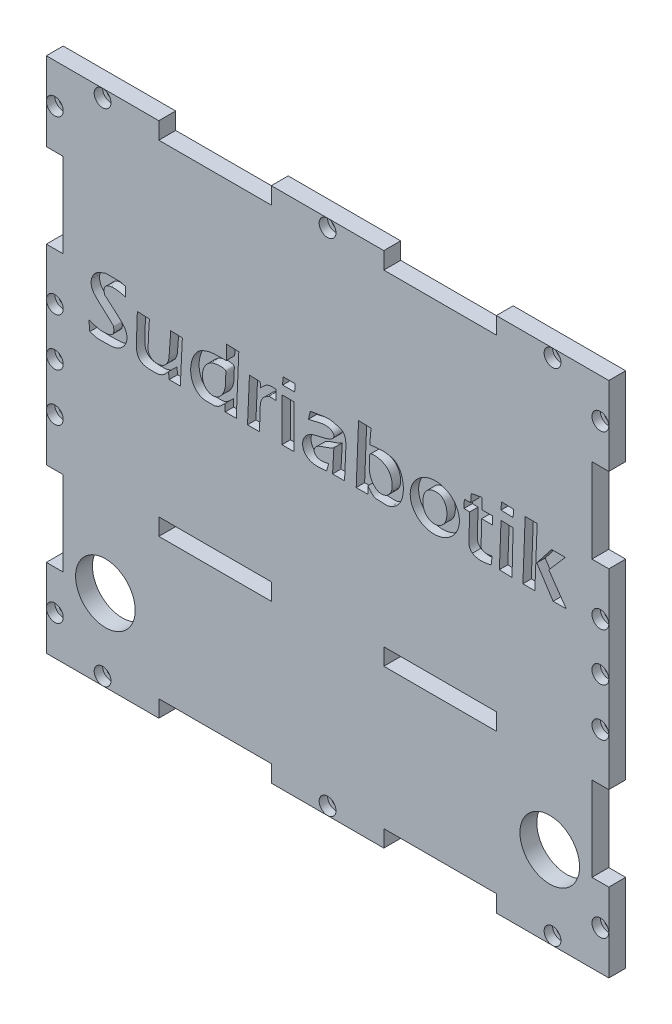
from build123d import *

# Parameters (mm, degrees)
ESQUISSE1_W             = 200
ESQUISSE1_H             = 184
BOSS_EXTRU_1_DEPTH      = 6
ESQUISSE2_W             = 40
ESQUISSE2_H             = 6
ESQUISSE2_W_2           = 6
ESQUISSE2_H_2           = 30
ENL_V_MAT_EXTRU_1_DEPTH = 6
ESQUISSE4_R             = 10.6
ENL_V_MAT_EXTRU_2_DEPTH = 10
ESQUISSE6_W             = 40
ESQUISSE6_H             = 6
ENL_V_MAT_EXTRU_3_DEPTH = 6
ESQUISSE7_R             = 1.5
ENL_V_MAT_EXTRU_4_DEPTH = 6
ESQUISSE8_R             = 2.995
ENL_V_MAT_EXTRU_5_DEPTH = 3
ENL_V_START             = -3
ENL_V_MAT_EXTRU_7_DEPTH = 3


# Read off the part's stored shape, not the designer's step: Enlèv. mat.-Extru.7
with BuildPart() as part:
    # Esquisse1 → Boss.-Extru.1 (new body)
    with BuildSketch(Plane.XY):
        Rectangle(ESQUISSE1_W, ESQUISSE1_H)
    extrude(amount=BOSS_EXTRU_1_DEPTH)

    # Esquisse2 → Enlèv. mat.-Extru.1 (cut)
    with BuildSketch(Plane.XY.offset(6)):
        with Locations((-40, 89)):
            Rectangle(ESQUISSE2_W, ESQUISSE2_H)
        with Locations((40, 89)):
            Rectangle(ESQUISSE2_W, ESQUISSE2_H)
        with Locations((-97, 49)):
            Rectangle(ESQUISSE2_W_2, ESQUISSE2_H_2)
        with Locations((-97, -49)):
            Rectangle(ESQUISSE2_W_2, ESQUISSE2_H_2)
        with Locations((97, -49)):
            Rectangle(ESQUISSE2_W_2, ESQUISSE2_H_2)
        with Locations((97, 49)):
            Rectangle(ESQUISSE2_W_2, ESQUISSE2_H_2)
        with Locations((-40, -89)):
            Rectangle(ESQUISSE2_W, ESQUISSE2_H)
        with Locations((40, -89)):
            Rectangle(ESQUISSE2_W, ESQUISSE2_H)
    extrude(amount=-ENL_V_MAT_EXTRU_1_DEPTH, mode=Mode.SUBTRACT)

    # Esquisse4 → Enlèv. mat.-Extru.2 (cut)
    with BuildSketch(Plane(origin=(0, 0, 0), x_dir=(-1, 0, 0), z_dir=(0, 0, -1))):
        with Locations((-79.000000012, -62.999999968)):
            Circle(ESQUISSE4_R)
        with Locations((79, -63)):
            Circle(ESQUISSE4_R)
    extrude(amount=-ENL_V_MAT_EXTRU_2_DEPTH, mode=Mode.SUBTRACT)

    # Esquisse6 → Enlèv. mat.-Extru.3 (cut)
    with BuildSketch(Plane(origin=(0, 0, 0), x_dir=(-1, 0, 0), z_dir=(0, 0, -1))):
        with Locations((-40, -33)):
            Rectangle(ESQUISSE6_W, ESQUISSE6_H)
        with Locations((40, -33)):
            Rectangle(ESQUISSE6_W, ESQUISSE6_H)
    extrude(amount=-ENL_V_MAT_EXTRU_3_DEPTH, mode=Mode.SUBTRACT)

    # Esquisse7 → Enlèv. mat.-Extru.4 (cut)
    with BuildSketch(Plane.XY.offset(6)):
        with Locations(Location((0, 89, 0), (0, 0, 180))):
            Circle(ESQUISSE7_R)
        with Locations((97, 0)):
            Circle(ESQUISSE7_R)
        with Locations((-97, 0)):
            Circle(ESQUISSE7_R)
        with Locations((-80, 89)):
            Circle(ESQUISSE7_R)
        with Locations((-97, 78)):
            Circle(ESQUISSE7_R)
        with Locations(Location((97, 78, 0), (0, 0, 180))):
            Circle(ESQUISSE7_R)
        with Locations(Location((80, 89, 0), (0, 0, 180))):
            Circle(ESQUISSE7_R)
        with Locations((80, -89)):
            Circle(ESQUISSE7_R)
        with Locations((97, -78)):
            Circle(ESQUISSE7_R)
        with Locations(Location((-97, -78, 0), (0, 0, 180))):
            Circle(ESQUISSE7_R)
        with Locations(Location((-80, -89, 0), (0, 0, 180))):
            Circle(ESQUISSE7_R)
        with Locations((-97, 17)):
            Circle(ESQUISSE7_R)
        with Locations(Location((-97, -17, 0), (0, 0, 180))):
            Circle(ESQUISSE7_R)
        with Locations((97, -17)):
            Circle(ESQUISSE7_R)
        with Locations(Location((97, 17, 0), (0, 0, 180))):
            Circle(ESQUISSE7_R)
        with Locations((0, -89)):
            Circle(ESQUISSE7_R)
    extrude(amount=-ENL_V_MAT_EXTRU_4_DEPTH, mode=Mode.SUBTRACT)

    # Esquisse8 → Enlèv. mat.-Extru.5 (cut)
    with BuildSketch(Plane.XY.offset(6)):
        with Locations((-97, 0)):
            Circle(ESQUISSE8_R)
        with Locations((97, 0)):
            Circle(ESQUISSE8_R)
        with Locations((0, 89)):
            Circle(ESQUISSE8_R)
        with Locations((-97, -78)):
            Circle(ESQUISSE8_R)
        with Locations((-80, -89)):
            Circle(ESQUISSE8_R)
        with Locations(Location((80, -89, 0), (0, 0, 180))):
            Circle(ESQUISSE8_R)
        with Locations(Location((97, -78, 0), (0, 0, 180))):
            Circle(ESQUISSE8_R)
        with Locations((97, 78)):
            Circle(ESQUISSE8_R)
        with Locations((80, 89)):
            Circle(ESQUISSE8_R)
        with Locations(Location((-80, 89, 0), (0, 0, 180))):
            Circle(ESQUISSE8_R)
        with Locations(Location((-97, 78, 0), (0, 0, 180))):
            Circle(ESQUISSE8_R)
        with Locations((-97, 17)):
            Circle(ESQUISSE8_R)
        with Locations((-97, -17)):
            Circle(ESQUISSE8_R)
        with Locations(Location((97, -17, 0), (0, 0, 180))):
            Circle(ESQUISSE8_R)
        with Locations(Location((97, 17, 0), (0, 0, 180))):
            Circle(ESQUISSE8_R)
        with Locations(Location((0, -89, 0), (0, 0, 180))):
            Circle(ESQUISSE8_R)
    extrude(amount=-ENL_V_MAT_EXTRU_5_DEPTH, mode=Mode.SUBTRACT)

    # Enlèv. mat.-Extru.7 outline → Enlèv. mat.-Extru.7 (cut)
    # profile 1 of 14: a face of its own
    with BuildSketch(Plane.XY.offset(6).offset(ENL_V_START)):
        with BuildLine():
            Line((-71.832274603, 31.775350087), (-71.832274603, 35.076040061))
            add(Edge.make_bspline(
                [(-71.832274603, 35.076040061), (-75.444418075, 35.592060557), (-70.361003489, 35.571143557), (-78.763723548, 35.571143557), (-79.051613727, 35.571143557), (-81.515454032, 34.561829061), (-81.734344525, 34.415902066), (-84.022707636, 32.890326659), (-84.960698486, 29.626776167), (-83.054620514, 27.319418622), (-81.989048152, 26.029515237), (-80.688212082, 24.949464617), (-79.423861543, 23.85369415), (-78.335828919, 22.910732542), (-77.306290441, 21.901157547), (-76.288206068, 20.883073173), (-76.233194568, 20.828061674), (-76.138429014, 20.794325898), (-76.123171569, 20.718038674), (-75.428216674, 17.243264199), (-77.631067434, 17.087279703), (-80.414068535, 17.087279703), (-80.748690424, 17.087279703), (-81.076831351, 17.183378586), (-81.404275527, 17.252314202), (-82.122477197, 17.403514553), (-82.844018368, 17.545787514), (-83.54972401, 17.747417698), (-83.814143096, 17.822966008), (-83.812323658, 17.940327953), (-84.87, 18.242521194)],
                knots=[0, 0, 0, 0, 1, 1, 1, 2, 2, 2, 3, 3, 3, 4, 4, 4, 5, 5, 5, 6, 6, 6, 7, 7, 7, 8, 8, 8, 9, 9, 9, 10, 10, 10, 10], degree=3))
            Line((-84.87, 18.242521194), (-84.539931003, 14.776796721))
            add(Edge.make_bspline(
                [(-84.539931003, 14.776796721), (-80.92259241, 13.972943701), (-83.913476475, 13.965242805), (-76.948344063, 14.116658727), (-73.316399376, 14.195614046), (-70.281527239, 17.649880516), (-71.667240104, 21.21314217), (-72.591261948, 23.589198341), (-76.80250554, 26.348407606), (-78.763723548, 28.309625614), (-78.928758047, 28.474660113), (-79.190189164, 28.581655999), (-79.258827044, 28.80472911), (-80.23577747, 31.979817995), (-77.617572533, 32.642538745), (-75.132964577, 32.435488082), (-74.014821462, 32.342309489), (-72.932504594, 31.995396085), (-71.832274603, 31.775350087)],
                knots=[0, 0, 0, 0, 1, 1, 1, 2, 2, 2, 3, 3, 3, 4, 4, 4, 5, 5, 5, 6, 6, 6, 6], degree=3))
        make_face()
    # profile 2 of 14: a face of its own
    with BuildSketch(Plane.XY.offset(6).offset(ENL_V_START)):
        with BuildLine():
            Line((-35.854753887, 35.24107456), (-36.019663664, 30.128871488))
            add(Edge.make_bspline(
                [(-36.019663664, 30.128871488), (-39.153732772, 30.101065387), (-41.993701799, 30.323488501), (-44.919462564, 28.729582703), (-48.995119726, 26.509232473), (-50.040512384, 18.499854074), (-46.617637632, 15.511236627), (-44.801291547, 13.925328876), (-43.181622248, 14.056352711), (-40.663452041, 14.078694431), (-40.328843322, 14.081663148), (-39.988864748, 14.137170552), (-39.674748181, 14.252507408), (-38.100157167, 14.830663405), (-37.742458015, 15.500933689), (-36.396150541, 16.757210706)],
                knots=[0, 0, 0, 0, 1, 1, 1, 2, 2, 2, 3, 3, 3, 4, 4, 4, 5, 5, 5, 5], degree=3))
            Line((-36.396150541, 16.757210706), (-36.396150541, 14.111775978))
            Line((-36.396150541, 14.111775978), (-32.461830671, 14.111775978))
            Line((-32.461830671, 14.111775978), (-31.563856921, 35.076040061))
            Line((-31.563856921, 35.076040061), (-35.854753887, 35.24107456))
        make_face()
        with BuildLine():
            add(Edge.make_bspline(
                [(-36.213007407, 26.824315126), (-36.770508032, 27.847371932), (-40.057823535, 27.38285396), (-41.649690342, 27.344614236), (-44.061546879, 26.947566468), (-43.701198768, 24.392165497), (-44.967721967, 23.835570442), (-44.952732727, 22.064495793), (-45.241959164, 19.924709536), (-46.32353477, 17.901713818), (-44.765170086, 15.731586823), (-41.21419285, 14.604050905), (-37.702792527, 14.196932027), (-37.514282923, 17.424745861), (-36.533817611, 19.174690279), (-36.32652025, 21.676728394), (-34.637556869, 23.00287742), (-37.827821034, 23.290626737), (-35.655506782, 25.80125832), (-36.213007407, 26.824315126)],
                knots=[0, 0, 0, 0, 0, 0, 0, 0, 0, 0, 0, 0, 0, 0, 0, 0, 0, 0, 0, 0, 1, 1, 1, 1, 1, 1, 1, 1, 1, 1, 1, 1, 1, 1, 1, 1, 1, 1, 1, 1], degree=19))
        make_face(mode=Mode.SUBTRACT)
    # profile 3 of 14: a face of its own
    with BuildSketch(Plane.XY.offset(6).offset(ENL_V_START)):
        with BuildLine():
            Line((14.315733716, 14.111775978), (14.315733716, 16.71063796))
            add(Edge.make_bspline(
                [(14.315733716, 16.71063796), (15.01441761, 16.011954067), (16.087203721, 14.321296852), (17.121320194, 14.23512048), (18.383405363, 14.129946716), (19.650653837, 14.070085981), (20.917113664, 14.070085981), (21.947384958, 14.070085981), (23.125399227, 14.717103863), (23.887734641, 15.225327472), (27.639413123, 17.72644646), (27.638597999, 24.165702993), (25.538079628, 27.602914874), (25.158292567, 28.224384609), (24.255696789, 29.15653268), (23.557665643, 29.41829436), (20.627655537, 30.517048149), (18.216920146, 30.08364423), (14.975871711, 29.748363357)],
                knots=[0, 0, 0, 0, 1, 1, 1, 2, 2, 2, 3, 3, 3, 4, 4, 4, 5, 5, 5, 6, 6, 6, 6], degree=3))
            Line((14.975871711, 29.748363357), (15.470975207, 35.029467315))
            Line((15.470975207, 35.029467315), (11.015043742, 35.194501814))
            Line((11.015043742, 35.194501814), (10.178427638, 14.111775978))
            Line((10.178427638, 14.111775978), (14.315733716, 14.111775978))
        make_face()
        with BuildLine():
            add(Edge.make_bspline(
                [(15.051477534, 26.817766588), (14.4292009, 25.832767114), (16.233873095, 23.314534792), (13.233014276, 23.105809973), (14.832997235, 21.673565904), (14.878609608, 19.16336941), (15.74425425, 17.353873058), (15.72434236, 14.120620588), (19.254680906, 14.300586599), (22.870944288, 15.196921207), (24.565931783, 17.262101357), (23.616984956, 19.350597799), (23.466267043, 21.504575809), (23.595369225, 23.271002348), (22.367351161, 23.908066476), (22.891643309, 26.434930664), (20.510390385, 26.986594867), (18.722979632, 27.254532691), (15.673754168, 27.802766063), (15.051477534, 26.817766588)],
                knots=[0, 0, 0, 0, 0, 0, 0, 0, 0, 0, 0, 0, 0, 0, 0, 0, 0, 0, 0, 0, 1, 1, 1, 1, 1, 1, 1, 1, 1, 1, 1, 1, 1, 1, 1, 1, 1, 1, 1, 1], degree=19))
        make_face(mode=Mode.SUBTRACT)
    # profile 4 of 14: a face of its own
    with BuildSketch(Plane.XY.offset(6).offset(ENL_V_START)):
        with BuildLine():
            Line((58.534231493, 17.209633661), (57.059668878, 16.922245204))
            add(Edge.make_bspline(
                [(57.059668878, 16.922245204), (56.509553883, 16.977256704), (55.933811733, 16.912450422), (55.409323892, 17.087279703), (55.075154501, 17.1986695), (54.859208896, 17.5273717), (54.584151398, 17.747417698)],
                knots=[0, 0, 0, 0, 1, 1, 1, 2, 2, 2, 2], degree=3))
            Line((54.584151398, 17.747417698), (54.773897403, 26.824315126))
            Line((54.773897403, 26.824315126), (58.710013865, 26.824315126))
            Line((58.710013865, 26.824315126), (58.710013865, 29.629901604))
            Line((58.710013865, 29.629901604), (54.914220395, 29.629901604))
            Line((54.914220395, 29.629901604), (54.914220395, 33.425695074))
            Line((54.914220395, 33.425695074), (54.584151398, 33.425695074))
            Line((54.584151398, 33.425695074), (51.118426925, 32.765557079))
            Line((51.118426925, 32.765557079), (50.871443908, 29.794936103))
            Line((50.871443908, 29.794936103), (48.642909445, 29.794936103))
            Line((48.642909445, 29.794936103), (48.497786628, 26.824315126))
            Line((48.497786628, 26.824315126), (50.508507889, 26.768751477))
            add(Edge.make_bspline(
                [(50.508507889, 26.768751477), (50.453539896, 24.3372525), (50.449969548, 21.904047769), (50.343603909, 19.474254546), (50.292890852, 18.315776665), (50.154207376, 17.124406219), (50.422984111, 15.996398293), (50.480447319, 15.755235478), (50.971848976, 14.990281361), (51.478439966, 14.544237043)],
                knots=[1.305700193, 1.305700193, 1.305700193, 1.305700193, 2.305700193, 2.305700193, 2.305700193, 3.305700193, 3.305700193, 3.305700193, 4, 4, 4, 4], degree=3))
            add(Edge.make_bspline(
                [(51.478439966, 14.544237043), (54.122648347, 13.117415432), (56.316025086, 13.952464869), (57.480594776, 14.12), (58.154811729, 14.281693225)],
                knots=[0, 0, 0, 0, 0, 1, 1, 1, 1, 1], degree=4))
            Line((58.154811729, 14.281693225), (58.534231493, 17.209633661))
        make_face()
    # profile 5 of 14: a face of its own
    with BuildSketch(Plane.XY.offset(6).offset(ENL_V_START)):
        with BuildLine():
            Line((-18.361097026, 26.628871451), (-18.361097026, 30.1250051))
            add(Edge.make_bspline(
                [(-18.361097026, 30.1250051), (-21.315613192, 30.393597479), (-21.705284977, 29.916472624), (-23.807235483, 27.814522118)],
                knots=[0, 0, 0, 0, 1, 1, 1, 1], degree=3))
            Line((-23.807235483, 27.814522118), (-23.972269981, 29.629901604))
            Line((-23.972269981, 29.629901604), (-27.768063451, 29.794936103))
            Line((-27.768063451, 29.794936103), (-28.469276484, 14.111775978))
            Line((-28.469276484, 14.111775978), (-24.176043536, 14.111775978))
            add(Edge.make_bspline(
                [(-24.176043536, 14.111775978), (-24.122694836, 16.534193816), (-24.104476162, 18.957640266), (-24.015997437, 21.379029491), (-23.920034803, 24.00523017), (-23.329683884, 25.503860342), (-21.000925865, 26.567077813), (-20.930154969, 26.599388964), (-20.917575368, 26.734108605), (-20.839798665, 26.735929218), (-20.01302097, 26.755282594), (-19.187330905, 26.664557373), (-18.361097026, 26.628871451)],
                knots=[0, 0, 0, 0, 1, 1, 1, 2, 2, 2, 3, 3, 3, 4, 4, 4, 4], degree=3))
        make_face()
    # profile 6 of 14: a face of its own
    with BuildSketch(Plane.XY.offset(6).offset(ENL_V_START)):
        with BuildLine():
            Line((6.03421537, 14.111775978), (6.559112278, 25.834108134))
            add(Edge.make_bspline(
                [(6.559112278, 25.834108134), (6.288171736, 27.324281115), (6.426788657, 27.833188198), (5.403870787, 28.969763609), (4.989042825, 29.430683567), (3.147277968, 29.880361634), (2.928353306, 29.959970601), (-0.011300684, 31.028935689), (-3.201098633, 29.792361048), (-6.148544122, 29.464867105)],
                knots=[0, 0, 0, 0, 1, 1, 1, 2, 2, 2, 3, 3, 3, 3], degree=3))
            Line((-6.148544122, 29.464867105), (-6.808682117, 26.659280627))
            add(Edge.make_bspline(
                [(-6.808682117, 26.659280627), (-2.96649641, 27.619827054), (-1.094002081, 27.997276809), (1.328557302, 28.971295529), (3.380656572, 26.739689603), (3.130735869, 25.481313483), (1.880431869, 24.519703915), (-1.028411046, 23.724475661)],
                knots=[0, 0, 0, 0, 0, 0, 0, 0, 1, 1, 1, 1, 1, 1, 1, 1], degree=7))
            add(Edge.make_bspline(
                [(-1.028411046, 23.724475661), (-2.201911295, 23.377360175), (-4.550032459, 22.81139558), (-8.106341621, 22.965762655), (-7.821635056, 21.708993667), (-10.914874822, 19.2145908), (-9.843269246, 16.420165715), (-8.534307515, 14.943578235), (-7.598230467, 13.828823758), (-5.312424389, 13.287937321), (-2.966524315, 13.74664657), (-0.356550374, 13.952464869)],
                knots=[0, 0, 0, 0, 0, 0, 0, 0, 0, 0, 0, 0, 1, 1, 1, 1, 1, 1, 1, 1, 1, 1, 1, 1], degree=11))
            Line((-0.356550374, 13.952464869), (0.367732791, 16.544695236))
            add(Edge.make_bspline(
                [(0.367732791, 16.544695236), (-1.097553052, 16.186628196), (-2.454542042, 16.186628196), (-3.975255041, 15.568179336), (-5.03966317, 16.320388885), (-5.862527852, 18.219881868), (-5.664745203, 19.366451979), (-4.54556026, 20.396116834), (-2.663037438, 20.382828011), (-1.48917677, 20.819723602), (-0.248057879, 21.16976583), (1.078561325, 21.631138885), (2.237383108, 22.415975288)],
                knots=[0, 0, 0, 0, 0, 0, 0, 0, 0, 0, 0, 0, 0, 1, 1, 1, 1, 1, 1, 1, 1, 1, 1, 1, 1, 1], degree=12))
            Line((2.237383108, 22.415975288), (1.772544987, 14.111775978))
            Line((1.772544987, 14.111775978), (6.03421537, 14.111775978))
        make_face()
    # profile 7 of 14: a face of its own
    with BuildSketch(Plane.XY.offset(6).offset(ENL_V_START)):
        with BuildLine():
            add(Edge.make_bspline(
                [(46.596661681, 24.26387342), (42.80047792, 38.109802448), (31.998420204, 27.704796277), (21.196362487, 17.299790106), (35.794603964, 13.858867249), (50.392845441, 10.417944392), (46.596661681, 24.26387342)],
                knots=[0, 0, 0, 2.094395102, 2.094395102, 4.188790205, 4.188790205, 6.283185307, 6.283185307, 6.283185307], degree=2, weights=[1, 0.5, 1, 0.5, 1, 0.5, 1]))
        make_face()
        with BuildLine():
            add(Edge.make_bspline(
                [(37.956332136, 26.944909021), (35.199291661, 26.608406674), (32.546383483, 25.418724668), (33.834169464, 20.165599202), (32.252989355, 17.649489861), (34.362681743, 16.325469139), (38.169941672, 13.623113462), (41.737810118, 16.480383386), (43.109563395, 17.034453149), (43.636756761, 20.592279527), (43.574545384, 26.764734053), (40.713372612, 27.281411367), (37.956332136, 26.944909021)],
                knots=[0, 0, 0, 0, 0, 0, 0, 0, 0, 0, 0, 0, 0, 1, 1, 1, 1, 1, 1, 1, 1, 1, 1, 1, 1, 1], degree=12))
        make_face(mode=Mode.SUBTRACT)
    # profile 8 of 14: a face of its own
    with BuildSketch(Plane.XY.offset(6).offset(ENL_V_START)):
        with BuildLine():
            Line((-63.349960991, 29.286076362), (-67.640857957, 29.451110861))
            add(Edge.make_bspline(
                [(-67.640857957, 29.451110861), (-67.750880956, 26.205432386), (-67.821199754, 22.958164768), (-67.970926954, 19.714075438), (-68.225951753, 14.188538131), (-65.797107714, 13.627470665), (-60.709409012, 13.772833485), (-60.255957609, 13.785789239), (-59.813886063, 13.943620092), (-59.389133022, 14.102902482), (-57.785731252, 14.704178146), (-57.68246804, 15.314463968), (-56.583546544, 16.413385464)],
                knots=[0, 0, 0, 0, 1, 1, 1, 2, 2, 2, 3, 3, 3, 4, 4, 4, 4], degree=3))
            Line((-56.583546544, 16.413385464), (-56.322468453, 14.111775978))
            Line((-56.322468453, 14.111775978), (-52.358203757, 14.111775978))
            Line((-52.358203757, 14.111775978), (-51.632511583, 29.286076362))
            Line((-51.632511583, 29.286076362), (-55.758374051, 29.451110861))
            add(Edge.make_bspline(
                [(-55.758374051, 29.451110861), (-55.923408549, 26.920581881), (-56.058982525, 24.387959206), (-56.253477547, 21.859523921), (-56.332246573, 20.835526579), (-56.534040722, 19.608858587), (-57.07865004, 18.723868445), (-58.78580273, 15.949745324), (-63.95983685, 16.314042638), (-63.845064487, 20.044144435), (-63.750184425, 23.127746463), (-63.514995489, 26.205432386), (-63.349960991, 29.286076362)],
                knots=[0, 0, 0, 0, 1, 1, 1, 2, 2, 2, 3, 3, 3, 4, 4, 4, 4], degree=3))
        make_face()
    # profile 9 of 14: a face of its own
    with BuildSketch(Plane.XY.offset(6).offset(ENL_V_START)):
        Polygon((-11.534540681, 35.238874682), (-15.828254392, 35.244567854), (-15.99328889, 32.604015875), (-11.699219357, 32.604015875), align=None)
    # profile 10 of 14: a face of its own
    with BuildSketch(Plane.XY.offset(6).offset(ENL_V_START)):
        Polygon((66.136566307, 35.406109058), (61.845669341, 35.571143557), (61.680634842, 32.930591578), (65.971531808, 32.765557079), align=None)
    # profile 11 of 14: a face of its own
    with BuildSketch(Plane.XY.offset(6).offset(ENL_V_START)):
        Polygon((-16.149050409, 29.474015875), (-16.21882111, 14.111775978), (-11.924751576, 14.111775978), (-11.854980875, 29.474015875), align=None)
    # profile 12 of 14: a face of its own
    with BuildSketch(Plane.XY.offset(6).offset(ENL_V_START)):
        Polygon((74.530239967, 35.24107456), (70.262428774, 35.24107456), (69.451609896, 14.12), (73.703613911, 14.12), align=None)
    # profile 13 of 14: a face of its own
    with BuildSketch(Plane.XY.offset(6).offset(ENL_V_START)):
        Polygon((74.388291242, 23.028521656), (80.20829598, 14.12), (84.872984554, 14.12), (78.652963855, 23.028521656), (84.551694648, 29.794936103), (79.6693952, 29.794936103), align=None)
    # profile 14 of 14: a face of its own
    with BuildSketch(Plane.XY.offset(6).offset(ENL_V_START)):
        Polygon((65.971531808, 29.629901604), (61.680634842, 29.794936103), (61.089175193, 14.281693225), (65.591449314, 14.12), align=None)
    extrude(amount=ENL_V_MAT_EXTRU_7_DEPTH, mode=Mode.SUBTRACT)


solid = part.part
